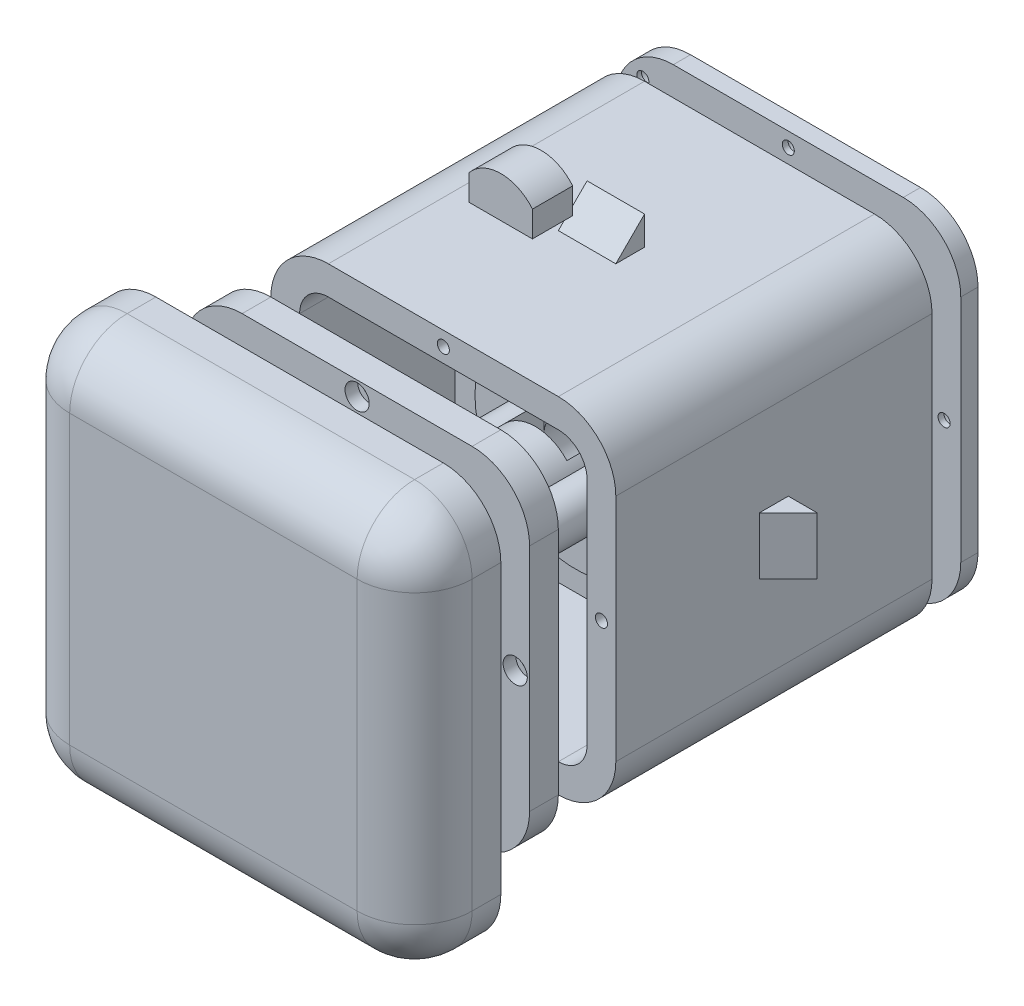
from build123d import *

# Parameters (mm, degrees)
SKETCH2_W                = 60
SKETCH2_H                = 60
BODY_DEPTH               = 60
FILLET7_R                = 10
SHELL8_T                 = -5
SKETCH17_W               = 70
SKETCH17_H               = 70
CAP_LOWER_DEPTH          = 15
FILLET9_R                = 10
BOSS_EXTRUDE1_DEPTH      = 18
BOSS_EXTRUDE1_DEPTH_BACK = 30
SKETCH21_R               = 7.5
SKETCH22_R               = 17.5
BOSS_EXTRUDE2_DEPTH      = 2
BOSS_EXTRUDE7_DEPTH      = 21
BOSS_EXTRUDE8_DEPTH      = 3
SKETCH103_R              = 8.5
CUT_EXTRUDE25_DEPTH      = 3
SKETCH104_R              = 9.5
BOSS_EXTRUDE9_DEPTH      = 3
SKETCH105_R              = 8.5
CUT_EXTRUDE26_DEPTH      = 3
CUT_EXTRUDE27_DEPTH      = 5
BOSS_EXTRUDE10_DEPTH     = 3
CUT_EXTRUDE30_DEPTH      = 10
SKETCH128_R              = 1.05
CUT_EXTRUDE33_DEPTH      = 7
CUT_EXTRUDE34_DEPTH      = 3
CUT_EXTRUDE34_DEPTH_BACK = 7.1
SKETCH129_R              = 1
SKETCH130_R              = 2.2
CUT_EXTRUDE35_DEPTH      = 2.2
SKETCH131_R              = 2.2
CUT_EXTRUDE36_DEPTH      = 2
CHAMFER3_START           = -10.419708029
CHAMFER3_3_DEPTH         = 14.739416058
SKETCH145_R              = 1.05
CUT_EXTRUDE40_DEPTH      = 11
CUT_EXTRUDE43_DEPTH      = 6
CUT_EXTRUDE43_DEPTH_BACK = 26
SKETCH151_R              = 5.5
CUT_EXTRUDE44_DEPTH      = 2.5
CUT_EXTRUDE44_DEPTH_BACK = 7
BOSS_EXTRUDE13_DEPTH     = 7
CUT_EXTRUDE58_DEPTH      = 5
SKETCH201_R              = 1
CUT_EXTRUDE59_DEPTH      = 15
SKETCH202_R              = 2.1
CUT_EXTRUDE60_DEPTH      = 2.2
SKETCH204_R              = 1.05
CUT_EXTRUDE61_DEPTH      = 7
CUT_EXTRUDE62_DEPTH      = 12
SKETCH206_W              = 12
SKETCH206_H              = 38
BOSS_EXTRUDE16_DEPTH     = 28
SKETCH213_W              = 3.696990866
SKETCH213_H              = 8
CUT_EXTRUDE64_DEPTH      = 1.5
CUT_EXTRUDE65_START      = -11
SKETCH215_R              = 1.05
CUT_EXTRUDE65_DEPTH      = 11
SHELL9_T                 = -5
FILLET15_R               = 10
FILLET16_R               = 10
BOSS_EXTRUDE17_DEPTH     = 8
CUT_EXTRUDE66_DEPTH      = 8
SKETCH234_R              = 1.5
CUT_EXTRUDE73_DEPTH      = 1.2
SKETCH235_R              = 0.8
CUT_EXTRUDE74_DEPTH      = 9
SKETCH391_W              = 3
SKETCH391_H              = 35
BOSS_EXTRUDE25_DEPTH     = 10
CUT_EXTRUDE75_START      = -10
CUT_EXTRUDE75_DEPTH      = 10
BOSS_EXTRUDE18_DEPTH     = 8
CUT_EXTRUDE76_DEPTH      = 8
SKETCH251_R              = 5.05
CUT_EXTRUDE79_DEPTH      = 15
SKETCH303_W              = 10
SKETCH303_H              = 5
BOSS_EXTRUDE19_DEPTH     = 5
CUT_EXTRUDE80_DEPTH      = 10
SKETCH305_W              = 5
SKETCH305_H              = 10
BOSS_EXTRUDE20_DEPTH     = 5
CUT_EXTRUDE81_DEPTH      = 10
SKETCH322_W              = 10
SKETCH322_H              = 37
CUT_EXTRUDE87_DEPTH      = 25
SKETCH336_W              = 8.67183587
SKETCH336_H              = 9.412023997
CUT_EXTRUDE96_DEPTH      = 1
SKETCH338_R              = 1.55
BOSS_EXTRUDE21_DEPTH     = 2.1
SKETCH339_R              = 1.05
CUT_EXTRUDE98_DEPTH      = 3
BOSS_EXTRUDE24_START     = 5
BOSS_EXTRUDE24_DEPTH     = 5
SKETCH371_R              = 1.05
CUT_EXTRUDE104_DEPTH     = 5
CUT_EXTRUDE105_DEPTH     = 5
SKETCH373_W              = 10
SKETCH373_H              = 25
CUT_EXTRUDE106_DEPTH     = 5
SKETCH374_R              = 2.1
CUT_EXTRUDE107_DEPTH     = 2.2


with BuildPart() as part:
    # Sketch2 → Body (new body)
    with BuildSketch(Plane.XY):
        Rectangle(SKETCH2_W, SKETCH2_H)
    extrude(amount=BODY_DEPTH)

    # Fillet7
    fillet7_edges = [part.edges().sort_by_distance(p)[0] for p in [
        (30, -30, 30),
        (-30, -30, 30),
        (-30, 30, 30),
        (30, 30, 30),
    ]]
    fillet(fillet7_edges, radius=FILLET7_R)

    # Shell8
    shell8_openings = [part.faces().sort_by_distance(p)[0] for p in [
        (0, 0, 60),
    ]]
    offset(amount=SHELL8_T, openings=shell8_openings, kind=Kind.INTERSECTION)

    # Sketch102 → Boss-Extrude8 (add)
    with BuildSketch(Plane.XY.offset(30)):
        with BuildLine():
            Line((-17.5, 26), (17.5, 26))
            ThreePointArc((17.5, 26), (24.571067812, 23.071067812), (27.5, 16))
            Line((27.5, 16), (27.5, -16))
            ThreePointArc((27.5, -16), (24.571067812, -23.071067812), (17.5, -26))
            Line((17.5, -26), (-17.5, -26))
            ThreePointArc((-17.5, -26), (-24.571067812, -23.071067812), (-27.5, -16))
            Line((-27.5, -16), (-27.5, 16))
            ThreePointArc((-27.5, 16), (-24.571067812, 23.071067812), (-17.5, 26))
        make_face()
    extrude(amount=BOSS_EXTRUDE8_DEPTH)

    # Sketch103 → Cut-Extrude25 (cut)
    with BuildSketch(Plane.XY.offset(33)):
        Circle(SKETCH103_R)
    extrude(amount=-CUT_EXTRUDE25_DEPTH, mode=Mode.SUBTRACT)

    # Sketch104 → Boss-Extrude9 (add)
    with BuildSketch(Plane.XY.offset(33)):
        Circle(SKETCH104_R)
    extrude(amount=BOSS_EXTRUDE9_DEPTH)

    # Sketch105 → Cut-Extrude26 (cut)
    with BuildSketch(Plane.XY.offset(36)):
        Circle(SKETCH105_R)
    extrude(amount=-CUT_EXTRUDE26_DEPTH, mode=Mode.SUBTRACT)

    # Sketch110 → Cut-Extrude27 (cut)
    with BuildSketch(Plane.XY.offset(5)):
        with BuildLine():
            Line((-20, 30), (20, 30))
            ThreePointArc((20, 30), (27.071067812, 27.071067812), (30, 20))
            Line((30, 20), (30, -20))
            ThreePointArc((30, -20), (27.071067812, -27.071067812), (20, -30))
            Line((20, -30), (-20, -30))
            ThreePointArc((-20, -30), (-27.071067812, -27.071067812), (-30, -20))
            Line((-30, -20), (-30, 20))
            ThreePointArc((-30, 20), (-27.071067812, 27.071067812), (-20, 30))
        make_face()
    extrude(amount=-CUT_EXTRUDE27_DEPTH, mode=Mode.SUBTRACT)

    # Sketch145 → Cut-Extrude40 (cut)
    with BuildSketch(Plane.XY.offset(60)):
        with Locations((0, 27.5)):
            Circle(SKETCH145_R)
        with Locations((0, -27.5)):
            Circle(SKETCH145_R)
        with Locations((27.5, 0)):
            Circle(SKETCH145_R)
    cut_extrude40 = extrude(amount=-CUT_EXTRUDE40_DEPTH, mode=Mode.SUBTRACT)

    # Sketch201 → Cut-Extrude59 (cut)
    with BuildSketch(Plane(origin=(0, 0, 5), x_dir=(-1, 0, 0), z_dir=(0, 0, -1))):
        with Locations((25.303300859, 25.303300859)):
            Circle(SKETCH201_R)
        with Locations((25.303300859, -25.303300859)):
            Circle(SKETCH201_R)
    extrude(amount=-CUT_EXTRUDE59_DEPTH, mode=Mode.SUBTRACT)

    # Sketch205 → Cut-Extrude62 (cut)
    with BuildSketch(Plane(origin=(0, 0, 30), x_dir=(-1, 0, 0), z_dir=(0, 0, -1))):
        with BuildLine():
            Line((20, 18.5), (28, 18.5))
            ThreePointArc((28, 18.5), (28.707106781, 18.207106781), (29, 17.5))
            Line((29, 17.5), (29, -17.5))
            ThreePointArc((29, -17.5), (28.707106781, -18.207106781), (28, -18.5))
            Line((28, -18.5), (20, -18.5))
            ThreePointArc((20, -18.5), (19.292893219, -18.207106781), (19, -17.5))
            Line((19, -17.5), (19, 17.5))
            ThreePointArc((19, 17.5), (19.292893219, 18.207106781), (20, 18.5))
        make_face()
    extrude(amount=CUT_EXTRUDE62_DEPTH, mode=Mode.SUBTRACT)

    # Sketch206 → Boss-Extrude16 (add)
    with BuildSketch(Plane.XY.offset(33)):
        with Locations((-24, 0)):
            Rectangle(SKETCH206_W, SKETCH206_H)
    extrude(amount=-BOSS_EXTRUDE16_DEPTH)

    # Sketch213 → Cut-Extrude64 (cut)
    with BuildSketch(Plane(origin=(0, 19, 0), x_dir=(1, 0, 0), z_dir=(0, 1, 0))):
        with Locations((-22.463721022, -19.651313025)):
            Rectangle(SKETCH213_W, SKETCH213_H)
    extrude(amount=-CUT_EXTRUDE64_DEPTH, mode=Mode.SUBTRACT)

    # Sketch215 → Cut-Extrude65 (cut)
    with BuildSketch(Plane(origin=(0, 0, 5), x_dir=(-1, 0, 0), z_dir=(0, 0, -1)).offset(CUT_EXTRUDE65_START)):
        with Locations(Location((0, 27.5, 0), (0, 0, 180))):
            Circle(SKETCH215_R)
        with Locations(Location((0, -27.5, 0), (0, 0, 180))):
            Circle(SKETCH215_R)
        with Locations(Location((-27.5, 0, 0), (0, 0, 180))):
            Circle(SKETCH215_R)
    extrude(amount=CUT_EXTRUDE65_DEPTH, mode=Mode.SUBTRACT)

    # Sketch303 → Boss-Extrude19 (add)
    with BuildSketch(Plane(origin=(0, 30, 0), x_dir=(1, 0, 0), z_dir=(0, 1, 0))):
        with Locations((0, -32.5)):
            Rectangle(SKETCH303_W, SKETCH303_H)
    boss_extrude19 = extrude(amount=BOSS_EXTRUDE19_DEPTH)

    # Sketch304 → Cut-Extrude80 (cut)
    with BuildSketch(Plane(origin=(5, 0, 0), x_dir=(0, 0, -1), z_dir=(1, 0, 0))):
        Polygon((-35, 30), (-30, 35), (-35, 35), align=None)
    cut_extrude80 = extrude(amount=-CUT_EXTRUDE80_DEPTH, mode=Mode.SUBTRACT)

    # Mirror1: Boss-Extrude19, Cut-Extrude80 across plane
    add(boss_extrude19.mirror(Plane.ZX))
    add(cut_extrude80.mirror(Plane.ZX), mode=Mode.SUBTRACT)

    # Sketch305 → Boss-Extrude20 (add)
    with BuildSketch(Plane(origin=(30, 0, 0), x_dir=(0, 0, -1), z_dir=(1, 0, 0))):
        with Locations((-32.5, 0)):
            Rectangle(SKETCH305_W, SKETCH305_H)
    boss_extrude20 = extrude(amount=BOSS_EXTRUDE20_DEPTH)

    # Sketch306 → Cut-Extrude81 (cut)
    with BuildSketch(Plane.XZ.offset(5)):
        Polygon((30, 35), (35, 30), (35, 35), align=None)
    cut_extrude81 = extrude(amount=-CUT_EXTRUDE81_DEPTH, mode=Mode.SUBTRACT)

    # Mirror2: Boss-Extrude20, Cut-Extrude81 across plane
    add(boss_extrude20.mirror(Plane(origin=(0, 0, 0), x_dir=(0, 0, 1), z_dir=(1, 0, 0))))
    add(cut_extrude81.mirror(Plane(origin=(0, 0, 0), x_dir=(0, 0, 1), z_dir=(1, 0, 0))), mode=Mode.SUBTRACT)

    # Sketch322 → Cut-Extrude87 (cut)
    with BuildSketch(Plane(origin=(0, 0, 5), x_dir=(-1, 0, 0), z_dir=(0, 0, -1))):
        with Locations((23.5, 0)):
            Rectangle(SKETCH322_W, SKETCH322_H)
    extrude(amount=-CUT_EXTRUDE87_DEPTH, mode=Mode.SUBTRACT)

    # Sketch336 → Cut-Extrude96 (cut)
    with BuildSketch(Plane.XZ.offset(-18.5)):
        with Locations((-20.698239463, 16.325048157)):
            Rectangle(SKETCH336_W, SKETCH336_H)
    extrude(amount=-CUT_EXTRUDE96_DEPTH, mode=Mode.SUBTRACT)

    # Mirror8: Cut-Extrude40 across plane
    add(cut_extrude40.mirror(Plane(origin=(0, 0, 0), x_dir=(0, 0, 1), z_dir=(1, 0, 0))), mode=Mode.SUBTRACT)

    # Sketch373 → Cut-Extrude106 (cut)
    with BuildSketch(Plane.XZ.offset(-18.5)):
        with Locations((-23.5, 17.5)):
            Rectangle(SKETCH373_W, SKETCH373_H)
    extrude(amount=-CUT_EXTRUDE106_DEPTH, mode=Mode.SUBTRACT)


with BuildPart() as body_2:
    # Sketch17 → Cap Lower (new body)
    with BuildSketch(Plane.XY.offset(100)):
        Rectangle(SKETCH17_W, SKETCH17_H)
    extrude(amount=-CAP_LOWER_DEPTH)

    # Fillet9
    fillet9_edges = [body_2.edges().sort_by_distance(p)[0] for p in [
        (0, -35, 100),
        (-35, 0, 100),
        (0, 35, 100),
        (35, 0, 100),
    ]]
    fillet(fillet9_edges, radius=FILLET9_R)

    # Shell9
    shell9_openings = [body_2.faces().sort_by_distance(p)[0] for p in [
        (0, 0, 85),
    ]]
    offset(amount=SHELL9_T, openings=shell9_openings)

    # Fillet15
    # the kernel refuses this fillet: 10 mm, written as the material it adds along each edge
    with BuildSketch(Plane(origin=(-20, 20, 95), x_dir=(0, 1, 0), z_dir=(1, 0, 0))) as fillet15_piece_1:
        with BuildLine():
            CenterArc((5, -5), 5, 0, 90)
            Line((10, -5), (10, 0))
            Line((10, 0), (5, 0))
        make_face()
    revolve(axis=Axis((-20, 20, 95), (0, 0, 1)), revolution_arc=90)
    with BuildSketch(Plane(origin=(20, 20, 95), x_dir=(1, 0, 0), z_dir=(0, -1, 0))) as fillet15_piece_2:
        with BuildLine():
            CenterArc((5, -5), 5, 0, 90)
            Line((10, -5), (10, 0))
            Line((10, 0), (5, 0))
        make_face()
    revolve(axis=Axis((20, 20, 95), (0, 0, 1)), revolution_arc=90)
    with BuildSketch(Plane(origin=(-20, -20, 95), x_dir=(-1, 0, 0), z_dir=(0, 1, 0))) as fillet15_piece_3:
        with BuildLine():
            CenterArc((5, -5), 5, 0, 90)
            Line((10, -5), (10, 0))
            Line((10, 0), (5, 0))
        make_face()
    revolve(axis=Axis((-20, -20, 95), (0, 0, 1)), revolution_arc=90)
    with BuildSketch(Plane(origin=(20, -20, 95), x_dir=(0, -1, 0), z_dir=(-1, 0, 0))) as fillet15_piece_4:
        with BuildLine():
            CenterArc((5, -5), 5, 0, 90)
            Line((10, -5), (10, 0))
            Line((10, 0), (5, 0))
        make_face()
    revolve(axis=Axis((20, -20, 95), (0, 0, 1)), revolution_arc=90)
    with BuildSketch(Plane(origin=(30, 30, 95), x_dir=(-1, 0, 0), z_dir=(0, 0, -1)), Plane(origin=(30, -30, 95), x_dir=(0, 1, 0), z_dir=(0, 0, -1)), Plane(origin=(-30, -30, 95), x_dir=(1, 0, 0), z_dir=(0, 0, -1)), Plane(origin=(-30, 30, 85), x_dir=(1, 0, 0), z_dir=(0, 0, 1))) as fillet15_piece_5:
        with BuildLine():
            CenterArc((FILLET15_R, -FILLET15_R), FILLET15_R, 90, 90)
            Line((0, -FILLET15_R), (0, 0))
            Line((0, 0), (FILLET15_R, 0))
        make_face()
    extrude(amount=10)

    # Fillet16
    # the kernel refuses this fillet: 10 mm, written as the material it takes off along each edge
    with BuildSketch(Plane(origin=(-25, 25, 90), x_dir=(-1, 0, 0), z_dir=(0, 1, 0))) as fillet16_piece_1_section:
        Polygon((0, 0), (FILLET16_R, 0), (FILLET16_R, FILLET16_R), (0, FILLET16_R), align=None)
    fillet16_piece_1 = extrude(amount=FILLET16_R, mode=Mode.PRIVATE)
    fillet16_piece_1 = fillet16_piece_1 - Plane(origin=(-25, 25, 90), x_dir=(0.7071067811865475, 0, -0.7071067811865475), z_dir=(0, 1, 0)) * Sphere(FILLET16_R, mode=Mode.PRIVATE)
    add(fillet16_piece_1, mode=Mode.SUBTRACT)
    with BuildSketch(Plane(origin=(25, 25, 90), x_dir=(1, 0, 0), z_dir=(0, 1, 0))) as fillet16_piece_2_section:
        Polygon((0, 0), (FILLET16_R, 0), (FILLET16_R, -FILLET16_R), (0, -FILLET16_R), align=None)
    fillet16_piece_2 = extrude(amount=FILLET16_R, mode=Mode.PRIVATE)
    fillet16_piece_2 = fillet16_piece_2 - Plane(origin=(25, 25, 90), x_dir=(-0.7071067811865475, 0, -0.7071067811865475), z_dir=(0, 1, 0)) * Sphere(FILLET16_R, mode=Mode.PRIVATE)
    add(fillet16_piece_2, mode=Mode.SUBTRACT)
    with BuildSketch(Plane(origin=(-25, -25, 90), x_dir=(-1, 0, 0), z_dir=(0, -1, 0))) as fillet16_piece_3_section:
        Polygon((0, 0), (FILLET16_R, 0), (FILLET16_R, -FILLET16_R), (0, -FILLET16_R), align=None)
    fillet16_piece_3 = extrude(amount=FILLET16_R, mode=Mode.PRIVATE)
    fillet16_piece_3 = fillet16_piece_3 - Plane(origin=(-25, -25, 90), x_dir=(0.7071067811865475, 0, -0.7071067811865475), z_dir=(0, -1, 0)) * Sphere(FILLET16_R, mode=Mode.PRIVATE)
    add(fillet16_piece_3, mode=Mode.SUBTRACT)
    with BuildSketch(Plane(origin=(25, -25, 90), x_dir=(0, -1, 0), z_dir=(1, 0, 0))) as fillet16_piece_4_section:
        Polygon((0, 0), (FILLET16_R, 0), (FILLET16_R, -FILLET16_R), (0, -FILLET16_R), align=None)
    fillet16_piece_4 = extrude(amount=FILLET16_R, mode=Mode.PRIVATE)
    fillet16_piece_4 = fillet16_piece_4 - Plane(origin=(25, -25, 90), x_dir=(0, 0.7071067811865475, -0.7071067811865475), z_dir=(1, 0, 0)) * Sphere(FILLET16_R, mode=Mode.PRIVATE)
    add(fillet16_piece_4, mode=Mode.SUBTRACT)
    with BuildSketch(Plane(origin=(35, -35, 90), x_dir=(0, 1, 0), z_dir=(0, 0, -1)), Plane(origin=(-35, -35, 90), x_dir=(1, 0, 0), z_dir=(0, 0, -1)), Plane(origin=(35, 35, 90), x_dir=(-1, 0, 0), z_dir=(0, 0, -1))) as fillet16_piece_5:
        with BuildLine():
            CenterArc((FILLET16_R, -FILLET16_R), FILLET16_R, 90, 90)
            Line((0, -FILLET16_R), (0, 0))
            Line((0, 0), (FILLET16_R, 0))
        make_face()
    extrude(amount=30, mode=Mode.SUBTRACT)
    with BuildSketch(Plane(origin=(-35, 35, 90), x_dir=(1, 0, 0), z_dir=(0, 0, -1))) as fillet16_piece_6:
        with BuildLine():
            CenterArc((FILLET16_R, FILLET16_R), FILLET16_R, 180, 90)
            Line((0, FILLET16_R), (0, 0))
            Line((0, 0), (FILLET16_R, 0))
        make_face()
    extrude(amount=30, mode=Mode.SUBTRACT)

    # Sketch221 → Boss-Extrude17 (add)
    with BuildSketch(Plane(origin=(0, 0, 95), x_dir=(-1, 0, 0), z_dir=(0, 0, -1))):
        with BuildLine():
            ThreePointArc((-10.346153846, -7.014777302), (0, -12.5), (10.346153846, -7.014777302))
            ThreePointArc((10.346153846, -7.014777302), (20.5, 0), (10.346153846, 7.014777302))
            ThreePointArc((10.346153846, 7.014777302), (0, 12.5), (-10.346153846, 7.014777302))
            ThreePointArc((-10.346153846, 7.014777302), (-20.5, 0), (-10.346153846, -7.014777302))
        make_face()
    extrude(amount=BOSS_EXTRUDE17_DEPTH)

    # Sketch222 → Cut-Extrude66 (cut)
    with BuildSketch(Plane(origin=(0, 0, 87), x_dir=(-1, 0, 0), z_dir=(0, 0, -1))):
        with BuildLine():
            ThreePointArc((-6.515625, -3.714381625), (0, -7.5), (6.515625, -3.714381625))
            ThreePointArc((6.515625, -3.714381625), (12, 0), (6.515625, 3.714381625))
            ThreePointArc((6.515625, 3.714381625), (0, 7.5), (-6.515625, 3.714381625))
            ThreePointArc((-6.515625, 3.714381625), (-12, 0), (-6.515625, -3.714381625))
        make_face()
    extrude(amount=-CUT_EXTRUDE66_DEPTH, mode=Mode.SUBTRACT)

    # Sketch234 → Cut-Extrude73 (cut)
    with BuildSketch(Plane(origin=(20.5, 0, 0), x_dir=(0, 0, -1), z_dir=(1, 0, 0))):
        with Locations((-91, 0)):
            Circle(SKETCH234_R)
    extrude(amount=-CUT_EXTRUDE73_DEPTH, mode=Mode.SUBTRACT)

    # Sketch235 → Cut-Extrude74 (cut)
    with BuildSketch(Plane(origin=(20.5, 0, 0), x_dir=(0, 0, -1), z_dir=(1, 0, 0))):
        with Locations((-91, 0)):
            Circle(SKETCH235_R)
    extrude(amount=-CUT_EXTRUDE74_DEPTH, mode=Mode.SUBTRACT)

    # Sketch245 → Cut-Extrude75 (cut)
    with BuildSketch(Plane(origin=(0, 0, 85), x_dir=(-1, 0, 0), z_dir=(0, 0, -1)).offset(CUT_EXTRUDE75_START)):
        with BuildLine():
            Line((-20, 30), (20, 30))
            ThreePointArc((20, 30), (27.071067812, 27.071067812), (30, 20))
            Line((30, 20), (30, -20))
            ThreePointArc((30, -20), (27.071067812, -27.071067812), (20, -30))
            Line((20, -30), (-20, -30))
            ThreePointArc((-20, -30), (-27.071067812, -27.071067812), (-30, -20))
            Line((-30, -20), (-30, 20))
            ThreePointArc((-30, 20), (-27.071067812, 27.071067812), (-20, 30))
        make_face()
    extrude(amount=CUT_EXTRUDE75_DEPTH, mode=Mode.SUBTRACT)

    # Sketch221<2> → Boss-Extrude18 (add)
    with BuildSketch(Plane(origin=(0, 0, 95), x_dir=(-1, 0, 0), z_dir=(0, 0, -1))):
        with BuildLine():
            ThreePointArc((-10.346153846, -7.014777302), (0, -12.5), (10.346153846, -7.014777302))
            ThreePointArc((10.346153846, -7.014777302), (20.5, 0), (10.346153846, 7.014777302))
            ThreePointArc((10.346153846, 7.014777302), (0, 12.5), (-10.346153846, 7.014777302))
            ThreePointArc((-10.346153846, 7.014777302), (-20.5, 0), (-10.346153846, -7.014777302))
        make_face()
    extrude(amount=BOSS_EXTRUDE18_DEPTH)

    # Sketch246 → Cut-Extrude76 (cut)
    with BuildSketch(Plane(origin=(0, 0, 87), x_dir=(-1, 0, 0), z_dir=(0, 0, -1))):
        with BuildLine():
            ThreePointArc((-6.734375, -4.3183554), (0, -8), (6.734375, -4.3183554))
            ThreePointArc((6.734375, -4.3183554), (12.5, 0), (6.734375, 4.3183554))
            ThreePointArc((6.734375, 4.3183554), (0, 8), (-6.734375, 4.3183554))
            ThreePointArc((-6.734375, 4.3183554), (-12.5, 0), (-6.734375, -4.3183554))
        make_face()
    extrude(amount=-CUT_EXTRUDE76_DEPTH, mode=Mode.SUBTRACT)


with BuildPart() as body_3:
    # Sketch21 → Boss-Extrude1 (new, two sides: drawn at the far end of the back side and taken through both)
    with BuildSketch(Plane.XY.offset(40).offset(-BOSS_EXTRUDE1_DEPTH_BACK)):
        Circle(SKETCH21_R)
    extrude(amount=BOSS_EXTRUDE1_DEPTH + BOSS_EXTRUDE1_DEPTH_BACK)

    # Sketch22 → Boss-Extrude2 (add)
    with BuildSketch(Plane.XY.offset(35)):
        Circle(SKETCH22_R)
    extrude(amount=BOSS_EXTRUDE2_DEPTH)

    # Sketch78 → Boss-Extrude7 (add)
    with BuildSketch(Plane.XY.offset(58)):
        with BuildLine():
            ThreePointArc((-6.515625, 3.714381625), (-12, 0), (-6.515625, -3.714381625))
            ThreePointArc((-6.515625, -3.714381625), (-7.5, 0), (-6.515625, 3.714381625))
        make_face()
        with BuildLine():
            ThreePointArc((6.515625, 3.714381625), (12, 0), (6.515625, -3.714381625))
            ThreePointArc((6.515625, -3.714381625), (7.5, 0), (6.515625, 3.714381625))
        make_face()
    extrude(amount=-BOSS_EXTRUDE7_DEPTH)

    # Sketch151 → Cut-Extrude43 (cut, two sides: drawn at the far end of the back side and taken through both)
    with BuildSketch(Plane.XY.offset(37).offset(-CUT_EXTRUDE43_DEPTH_BACK)):
        Circle(SKETCH151_R)
    extrude(amount=CUT_EXTRUDE43_DEPTH + CUT_EXTRUDE43_DEPTH_BACK, mode=Mode.SUBTRACT)

    # Sketch152 → Cut-Extrude44 (cut, two sides: drawn at the far end of the back side and taken through both)
    with BuildSketch(Plane(origin=(0, 5, 0), x_dir=(1, 0, 0), z_dir=(0, 1, 0)).offset(-CUT_EXTRUDE44_DEPTH_BACK)):
        Polygon((0, -37), (5.5, -37), (5.5, -44), (-5.5, -44), (-5.5, -37), align=None)
    extrude(amount=CUT_EXTRUDE44_DEPTH + CUT_EXTRUDE44_DEPTH_BACK, mode=Mode.SUBTRACT)

    # Sketch251 → Cut-Extrude79 (cut)
    with BuildSketch(Plane.XY.offset(36)):
        with Locations(Location((0, 0, 0), (0, 0, 203.330827283))):
            Circle(SKETCH251_R)
    extrude(amount=CUT_EXTRUDE79_DEPTH, mode=Mode.SUBTRACT)


with BuildPart() as body_4:
    # Sketch111 → Boss-Extrude10 (new body)
    with BuildSketch(Plane(origin=(0, 0, 0), x_dir=(-1, 0, 0), z_dir=(0, 0, -1))):
        with BuildLine():
            Line((-20, 30), (20, 30))
            ThreePointArc((20, 30), (27.071067812, 27.071067812), (30, 20))
            Line((30, 20), (30, -20))
            ThreePointArc((30, -20), (27.071067812, -27.071067812), (20, -30))
            Line((20, -30), (-20, -30))
            ThreePointArc((-20, -30), (-27.071067812, -27.071067812), (-30, -20))
            Line((-30, -20), (-30, 20))
            ThreePointArc((-30, 20), (-27.071067812, 27.071067812), (-20, 30))
        make_face()
    extrude(amount=BOSS_EXTRUDE10_DEPTH)

    # Sketch122 → Cut-Extrude30 (cut)
    with BuildSketch(Plane.XY):
        with BuildLine():
            Line((-4.124996137, 4.319708029), (-4.124996137, -10.419708029))
            ThreePointArc((-4.124996137, -10.419708029), (-0.5, -14.05), (3.124996137, -10.419708029))
            Line((3.124996137, -10.419708029), (3.124996137, 4.319708029))
            ThreePointArc((3.124996137, 4.319708029), (-0.5, 7.95), (-4.124996137, 4.319708029))
        make_face()
    extrude(amount=-CUT_EXTRUDE30_DEPTH, mode=Mode.SUBTRACT)

    # Sketch128 → Cut-Extrude33 (cut)
    with BuildSketch(Plane.XY):
        with Locations((27.1, 0)):
            Circle(SKETCH128_R)
        with Locations((0, 27.5)):
            Circle(SKETCH128_R)
        with Locations((0, -27.1)):
            Circle(SKETCH128_R)
    extrude(amount=-CUT_EXTRUDE33_DEPTH, mode=Mode.SUBTRACT)

    # Sketch129 → Cut-Extrude34 (cut, two sides: drawn at the far end of the back side and taken through both)
    with BuildSketch(Plane.XY.offset(-CUT_EXTRUDE34_DEPTH_BACK)):
        with Locations((-15.849, -18.476)):
            Circle(SKETCH129_R)
        with Locations((15.9, -18.476)):
            Circle(SKETCH129_R)
        with Locations((-15.849, 18.534)):
            Circle(SKETCH129_R)
        with Locations((15.9, 18.534)):
            Circle(SKETCH129_R)
    extrude(amount=CUT_EXTRUDE34_DEPTH + CUT_EXTRUDE34_DEPTH_BACK, mode=Mode.SUBTRACT)

    # Sketch130 → Cut-Extrude35 (cut)
    with BuildSketch(Plane(origin=(0, 0, -3), x_dir=(-1, 0, 0), z_dir=(0, 0, -1))):
        with Locations((-15.9, 18.534)):
            Circle(SKETCH130_R)
        with Locations((15.849, 18.534)):
            Circle(SKETCH130_R)
        with Locations((-15.9, -18.476)):
            Circle(SKETCH130_R)
        with Locations((15.849, -18.476)):
            Circle(SKETCH130_R)
    extrude(amount=-CUT_EXTRUDE35_DEPTH, mode=Mode.SUBTRACT)

    # Sketch131 → Cut-Extrude36 (cut)
    with BuildSketch(Plane(origin=(0, 0, -3), x_dir=(-1, 0, 0), z_dir=(0, 0, -1))):
        with Locations((0, -27.1)):
            Circle(SKETCH131_R)
        with Locations((0, 27.5)):
            Circle(SKETCH131_R)
        with Locations((-27.1, 0)):
            Circle(SKETCH131_R)
    extrude(amount=-CUT_EXTRUDE36_DEPTH, mode=Mode.SUBTRACT)

    # Chamfer3: read off the stored shape, not the designer's step
    # Chamfer3 outline → Chamfer3 (revolve, cut)
    with BuildSketch(Plane(origin=(-0.5, 4.325, 0), x_dir=(1, 0, 0), z_dir=(0, -1, 0))):
        Polygon((0, -3.000002611), (8.525002611, -3.000002611), (5.524999336, 6.64e-07), (0, 6.64e-07), align=None)
    revolve(axis=Axis((-0.5, 4.325, 0), (0, 0, 1)), mode=Mode.SUBTRACT)

    # Chamfer3 2 outline → Chamfer3 2 (revolve, cut)
    with BuildSketch(Plane(origin=(-0.5, -10.425, 0), x_dir=(1, 0, 0), z_dir=(0, -1, 0))):
        Polygon((0, -3), (8.525, -3), (5.524999336, 6.64e-07), (0, 6.64e-07), align=None)
    revolve(axis=Axis((-0.5, -10.425, 0), (0, 0, 1)), mode=Mode.SUBTRACT)

    # Chamfer3 3 outline → Chamfer3 3 (cut)
    with BuildSketch(Plane(origin=(0, 0, 0), x_dir=(1, 0, 0), z_dir=(0, 1, 0)).offset(CHAMFER3_START)):
        Polygon((8.024997247, 3), (-9.024996137, 3), (-6.024995125, -1.012e-06), (-4.124996137, 0), (3.124996137, 0), (5.024995125, 0), align=None)
    extrude(amount=CHAMFER3_3_DEPTH, mode=Mode.SUBTRACT)

    # Sketch197 → Cut-Extrude58 (cut)
    with BuildSketch(Plane.XY):
        with BuildLine():
            Line((-20, 18.5), (-28, 18.5))
            ThreePointArc((-28, 18.5), (-28.707106781, 18.207106781), (-29, 17.5))
            Line((-29, 17.5), (-29, -17.5))
            ThreePointArc((-29, -17.5), (-28.707106781, -18.207106781), (-28, -18.5))
            Line((-28, -18.5), (-20, -18.5))
            ThreePointArc((-20, -18.5), (-19.292893219, -18.207106781), (-19, -17.5))
            Line((-19, -17.5), (-19, 17.5))
            ThreePointArc((-19, 17.5), (-19.292893219, 18.207106781), (-20, 18.5))
        make_face()
    extrude(amount=-CUT_EXTRUDE58_DEPTH, mode=Mode.SUBTRACT)

    # Sketch202 → Cut-Extrude60 (cut)
    with BuildSketch(Plane(origin=(0, 0, -3), x_dir=(-1, 0, 0), z_dir=(0, 0, -1))):
        with Locations((25.303300859, -25.303300859)):
            Circle(SKETCH202_R)
        with Locations((25.303300859, 25.303300859)):
            Circle(SKETCH202_R)
    extrude(amount=-CUT_EXTRUDE60_DEPTH, mode=Mode.SUBTRACT)

    # Sketch204 → Cut-Extrude61 (cut)
    with BuildSketch(Plane(origin=(0, 0, -3), x_dir=(-1, 0, 0), z_dir=(0, 0, -1))):
        with Locations((25.303300859, 25.303300859)):
            Circle(SKETCH204_R)
        with Locations((25.303300859, -25.303300859)):
            Circle(SKETCH204_R)
    extrude(amount=-CUT_EXTRUDE61_DEPTH, mode=Mode.SUBTRACT)

    # Sketch391 → Boss-Extrude25 (add)
    with BuildSketch(Plane.ZY.offset(19)):
        with Locations((-1.5, 0)):
            Rectangle(SKETCH391_W, SKETCH391_H)
    extrude(amount=BOSS_EXTRUDE25_DEPTH)

    # Sketch338 → Boss-Extrude21 (add)
    with BuildSketch(Plane.XY):
        with Locations((-15.849, -18.476)):
            Circle(SKETCH338_R)
        with Locations((15.9, -18.476)):
            Circle(SKETCH338_R)
        with Locations((15.9, 18.534)):
            Circle(SKETCH338_R)
        with Locations((-15.849, 18.534)):
            Circle(SKETCH338_R)
    extrude(amount=BOSS_EXTRUDE21_DEPTH)

    # Sketch339 → Cut-Extrude98 (cut)
    with BuildSketch(Plane.XY.offset(2.1)):
        with Locations((-15.849, 18.534)):
            Circle(SKETCH339_R)
        with Locations((-15.849, -18.476)):
            Circle(SKETCH339_R)
        with Locations((15.9, 18.534)):
            Circle(SKETCH339_R)
        with Locations((15.9, -18.476)):
            Circle(SKETCH339_R)
    extrude(amount=-CUT_EXTRUDE98_DEPTH, mode=Mode.SUBTRACT)


with BuildPart() as body_5:
    # Sketch158 → Boss-Extrude13 (new body)
    with BuildSketch(Plane.XY.offset(43)):
        with BuildLine():
            Line((-5.5, 45.989988864), (-5.5, 41.5))
            Line((-5.5, 41.5), (5.5, 41.5))
            Line((5.5, 41.5), (5.5, 45.989988864))
            ThreePointArc((5.5, 45.989988864), (0, 48.6), (-5.5, 45.989988864))
        make_face()
    extrude(amount=BOSS_EXTRUDE13_DEPTH)


with BuildPart() as body_6:
    # Sketch368 → Boss-Extrude24 (new body)
    with BuildSketch(Plane.XY.offset(70).offset(BOSS_EXTRUDE24_START)):
        with BuildLine():
            Line((-20, 30), (20, 30))
            ThreePointArc((20, 30), (27.071067812, 27.071067812), (30, 20))
            Line((30, 20), (30, -20))
            ThreePointArc((30, -20), (27.071067812, -27.071067812), (20, -30))
            Line((20, -30), (-20, -30))
            ThreePointArc((-20, -30), (-27.071067812, -27.071067812), (-30, -20))
            Line((-30, -20), (-30, 20))
            ThreePointArc((-30, 20), (-27.071067812, 27.071067812), (-20, 30))
        make_face()
    extrude(amount=-BOSS_EXTRUDE24_DEPTH)

    # Sketch371 → Cut-Extrude104 (cut)
    with BuildSketch(Plane.XY.offset(75)):
        with Locations((-27.5, 0)):
            Circle(SKETCH371_R)
        with Locations(Location((27.5, 0, 0), (0, 0, 180))):
            Circle(SKETCH371_R)
        with Locations((0, -27.5)):
            Circle(SKETCH371_R)
        with Locations(Location((0, 27.5, 0), (0, 0, 180))):
            Circle(SKETCH371_R)
    extrude(amount=-CUT_EXTRUDE104_DEPTH, mode=Mode.SUBTRACT)

    # Sketch372 → Cut-Extrude105 (cut)
    with BuildSketch(Plane.XY.offset(75)):
        with BuildLine():
            ThreePointArc((6.821875, 4.549947416), (0, 8.2), (-6.821875, 4.549947416))
            ThreePointArc((-6.821875, 4.549947416), (-12.7, 0), (-6.821875, -4.549947416))
            ThreePointArc((-6.821875, -4.549947416), (0, -8.2), (6.821875, -4.549947416))
            ThreePointArc((6.821875, -4.549947416), (12.7, 0), (6.821875, 4.549947416))
        make_face()
    extrude(amount=-CUT_EXTRUDE105_DEPTH, mode=Mode.SUBTRACT)

    # Sketch374 → Cut-Extrude107 (cut)
    with BuildSketch(Plane.XY.offset(75)):
        with Locations((0, 27.5)):
            Circle(SKETCH374_R)
        with Locations((-27.5, 0)):
            Circle(SKETCH374_R)
        with Locations(Location((0, -27.5, 0), (0, 0, 180))):
            Circle(SKETCH374_R)
        with Locations(Location((27.5, 0, 0), (0, 0, 180))):
            Circle(SKETCH374_R)
    extrude(amount=-CUT_EXTRUDE107_DEPTH, mode=Mode.SUBTRACT)


solid = Compound([part.part, body_2.part, body_3.part, body_4.part, body_5.part, body_6.part])
